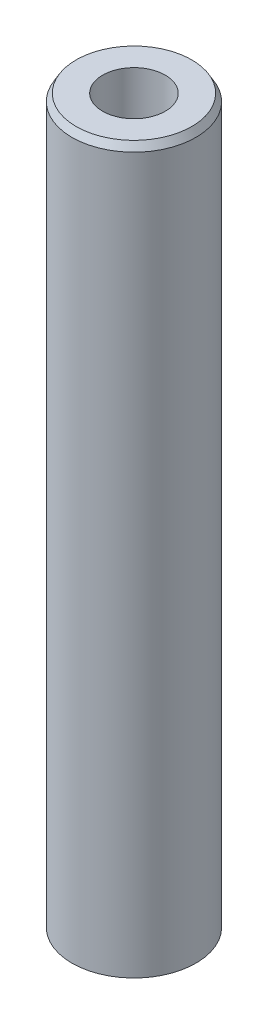
from build123d import *
from OCP.BRepFilletAPI import BRepFilletAPI_MakeChamfer

# Parameters (mm, degrees)
SKETCH1_R           = 25
BOSS_EXTRUDE1_DEPTH = 292.999830783
SKETCH2_R           = 12.633766733
CUT_EXTRUDE1_DEPTH  = 296.125229079
CHAMFER1_SIZE       = 2.938874735
CHAMFER1_SIZE2      = 1.696760119


with BuildPart() as part:
    # Sketch1 → Boss-Extrude1 (new body)
    with BuildSketch(Plane(origin=(0, 0, 0), x_dir=(1, 0, 0), z_dir=(0, 1, 0))):
        Circle(SKETCH1_R)
    extrude(amount=BOSS_EXTRUDE1_DEPTH)

    # Sketch2 → Cut-Extrude1 (cut, through all)
    with BuildSketch(Plane(origin=(0, 0, 0), x_dir=(1, 0, 0), z_dir=(0, 1, 0))):
        Circle(SKETCH2_R)
    extrude(amount=CUT_EXTRUDE1_DEPTH, mode=Mode.SUBTRACT)

    # Chamfer1: one chamfer whose edges measure the first distance from different faces: ONE call of the kernel's chamfer builder (chamfer() names one face for all edges)
    chamfer1_edges_1 = [part.edges().sort_by_distance(p)[0] for p in [
        (-25, 292.999830783, 0),
    ]]
    chamfer1_side_1 = [part.faces().sort_by_distance(p)[0] for p in [
        (-25, 146.499915392, 0),
    ]]
    chamfer1_edges_2 = [part.edges().sort_by_distance(p)[0] for p in [
        (-25, 0, 0),
    ]]
    chamfer1_side_2 = [part.faces().sort_by_distance(p)[0] for p in [
        (-24.292893219, 0, 0),
    ]]
    chamfer1 = BRepFilletAPI_MakeChamfer(part.part.solid().wrapped)
    for e in chamfer1_edges_1:
        chamfer1.Add(CHAMFER1_SIZE, CHAMFER1_SIZE2, e.wrapped, chamfer1_side_1[0].wrapped)  # the first distance lies on this face
    for e in chamfer1_edges_2:
        chamfer1.Add(CHAMFER1_SIZE, CHAMFER1_SIZE2, e.wrapped, chamfer1_side_2[0].wrapped)  # the first distance lies on this face
    add(Compound.cast(chamfer1.Shape()), mode=Mode.REPLACE)


solid = part.part
